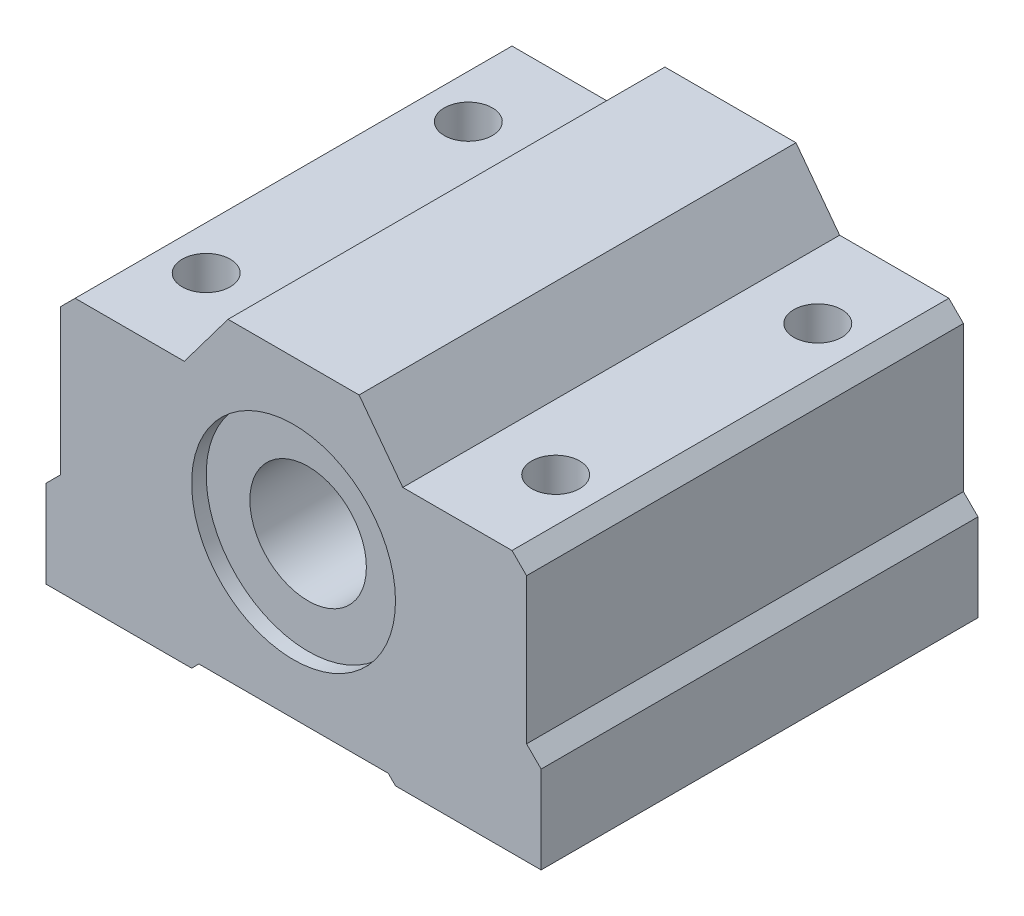
from build123d import *

# Parameters (mm, degrees)
BOSS_EXTRUDE1_DEPTH         = 30
SKETCH2_R                   = 4
CUT_EXTRUDE1_DEPTH          = 38.065042853
SKETCH3_R                   = 7
CUT_EXTRUDE2_DEPTH          = 1
CUT_EXTRUDE3_START          = -1
SKETCH4_R                   = 7
CUT_EXTRUDE3_DEPTH          = 1
TAP_DRILL_FOR_M4X0_7_TAP1_D = 3.3


with BuildPart() as part:
    # Sketch1 → Boss-Extrude1 (new body)
    with BuildSketch(Plane.XY):
        Polygon((-17, -2.405243596), (-17, -8.405243596), (-7, -8.405243596), (-6.5, -7.905243596), (6.5, -7.905243596), (7, -8.405243596), (17, -8.405243596), (17, -2.405243596), (16, -1.405243596), (16, 8.594756404), (15, 9.594756404), (7.5, 9.594756404), (4.5, 13.594756404), (-4.5, 13.594756404), (-7.5, 9.594756404), (-15, 9.594756404), (-16, 8.594756404), (-16, -1.405243596), align=None)
    extrude(amount=BOSS_EXTRUDE1_DEPTH)

    # Sketch2 → Cut-Extrude1 (cut, through all)
    with BuildSketch(Plane(origin=(0, 0, 0), x_dir=(-1, 0, 0), z_dir=(0, 0, -1))):
        with Locations((0, 2.594756404)):
            Circle(SKETCH2_R)
    extrude(amount=-CUT_EXTRUDE1_DEPTH, mode=Mode.SUBTRACT)

    # Sketch3 → Cut-Extrude2 (cut)
    with BuildSketch(Plane(origin=(0, 0, 0), x_dir=(-1, 0, 0), z_dir=(0, 0, -1))):
        with Locations((0, 2.594756404)):
            Circle(SKETCH3_R)
    extrude(amount=-CUT_EXTRUDE2_DEPTH, mode=Mode.SUBTRACT)

    # Sketch4 → Cut-Extrude3 (cut)
    with BuildSketch(Plane.XY.offset(30).offset(CUT_EXTRUDE3_START)):
        with Locations((0, 2.594756404)):
            Circle(SKETCH4_R)
    extrude(amount=CUT_EXTRUDE3_DEPTH, mode=Mode.SUBTRACT)

    # Tap Drill for M4x0.7 Tap1 (through all)
    with Locations(Plane(origin=(0, -8.405243596, 0), x_dir=(-1, 0, 0), z_dir=(0, -1, 0))):
        with Locations((-12, -6), (12, -6), (12, -24), (-12, -24)):
            Hole(TAP_DRILL_FOR_M4X0_7_TAP1_D / 2)


solid = part.part
